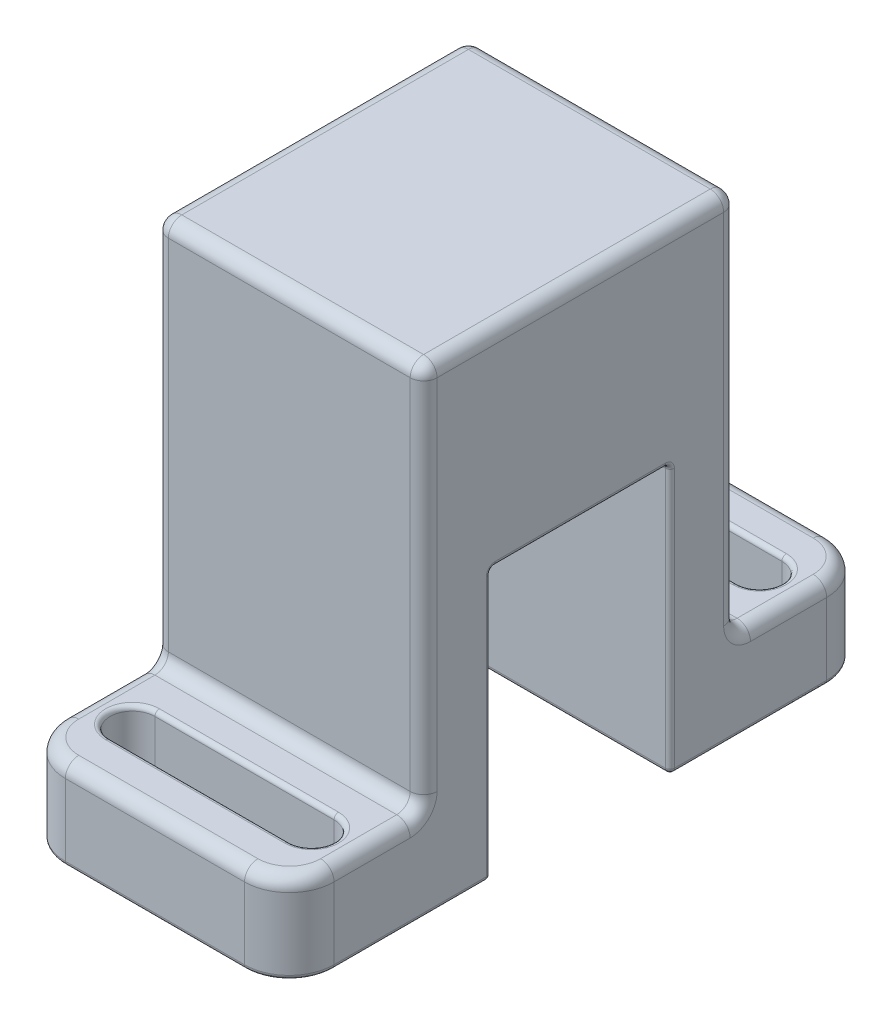
from build123d import *

# Parameters (mm, degrees)
SKETCH1_W               = 30
SKETCH1_H               = 35
BOSS_EXTRUDE1_DEPTH     = 53
SKETCH2_W               = 30
SKETCH2_H               = 65
BOSS_EXTRUDE2_DEPTH     = 10
CUT_EXTRUDE1_DEPTH      = 70.030790232
CUT_EXTRUDE1_DEPTH_BACK = 70.030790232
SKETCH3_W               = 20
SKETCH3_H               = 30
FILLET1_R               = 1.5
FILLET2_R               = 5
FILLET3_R               = 0.5


with BuildPart() as part:
    # Sketch1 → Boss-Extrude1 (new body)
    with BuildSketch(Plane(origin=(0, 0, 0), x_dir=(1, 0, 0), z_dir=(0, 1, 0))):
        Rectangle(SKETCH1_W, SKETCH1_H)
    extrude(amount=BOSS_EXTRUDE1_DEPTH)

    # Sketch2 → Boss-Extrude2 (add)
    with BuildSketch(Plane.XZ):
        Rectangle(SKETCH2_W, SKETCH2_H)
        with BuildLine():
            Line((-10, 27.5), (10, 27.5))
            ThreePointArc((10, 27.5), (12.5, 25), (10, 22.5))
            Line((10, 22.5), (-10, 22.5))
            ThreePointArc((-10, 22.5), (-12.5, 25), (-10, 27.5))
        make_face(mode=Mode.SUBTRACT)
        with BuildLine():
            Line((-10, -27.5), (10, -27.5))
            ThreePointArc((10, -27.5), (12.5, -25), (10, -22.5))
            Line((10, -22.5), (-10, -22.5))
            ThreePointArc((-10, -22.5), (-12.5, -25), (-10, -27.5))
        make_face(mode=Mode.SUBTRACT)
    extrude(amount=-BOSS_EXTRUDE2_DEPTH)

    # Sketch3 → Cut-Extrude1 (cut, two sides: drawn at the far end of the back side and taken through both)
    with BuildSketch(Plane.ZY.offset(15).offset(-CUT_EXTRUDE1_DEPTH_BACK)):
        with Locations((0, 15)):
            Rectangle(SKETCH3_W, SKETCH3_H)
    extrude(amount=CUT_EXTRUDE1_DEPTH + CUT_EXTRUDE1_DEPTH_BACK, mode=Mode.SUBTRACT)

    # Fillet1
    fillet1_edges = [part.edges().sort_by_distance(p)[0] for p in [
        (-15, 53, 0),
        (0, 10, 17.5),
        (0, 53, 17.5),
        (0, 10, -17.5),
        (15, 10, -25),
        (15, 10, 25),
        (-15, 10, -25),
        (-15, 10, 25),
        (0, 10, -32.5),
        (0, 10, 32.5),
        (15, 53, 0),
        (15, 31.5, 17.5),
        (-15, 31.5, 17.5),
        (-15, 31.5, -17.5),
        (15, 31.5, -17.5),
        (0, 53, -17.5),
    ]]
    fillet(fillet1_edges, radius=FILLET1_R)

    # Fillet2
    # the kernel refuses this fillet: 5 mm, written as the material it takes off along each edge
    with BuildSketch(Plane(origin=(-10, 10, 27.5), x_dir=(-1, 0, 0), z_dir=(0, 0, -1))) as fillet2_piece_1:
        with BuildLine():
            CenterArc((3.5, -1.5), 1.5, 0, 90)
            Line((5, -1.5), (5, 0))
            Line((5, 0), (3.5, 0))
        make_face()
    revolve(axis=Axis((-10, 10, 27.5), (0, 1, 0)), revolution_arc=90, mode=Mode.SUBTRACT)
    with BuildSketch(Plane(origin=(10, 10, 27.5), x_dir=(0, 0, 1), z_dir=(-1, 0, 0))) as fillet2_piece_2:
        with BuildLine():
            CenterArc((3.5, -1.5), 1.5, 0, 90)
            Line((5, -1.5), (5, 0))
            Line((5, 0), (3.5, 0))
        make_face()
    revolve(axis=Axis((10, 10, 27.5), (0, 1, 0)), revolution_arc=90, mode=Mode.SUBTRACT)
    with BuildSketch(Plane(origin=(-10, 10, -27.5), x_dir=(0, 0, -1), z_dir=(1, 0, 0))) as fillet2_piece_3:
        with BuildLine():
            CenterArc((3.5, -1.5), 1.5, 0, 90)
            Line((5, -1.5), (5, 0))
            Line((5, 0), (3.5, 0))
        make_face()
    revolve(axis=Axis((-10, 10, -27.5), (0, 1, 0)), revolution_arc=90, mode=Mode.SUBTRACT)
    with BuildSketch(Plane(origin=(10, 10, -27.5), x_dir=(1, 0, 0), z_dir=(0, 0, 1))) as fillet2_piece_4:
        with BuildLine():
            CenterArc((3.5, -1.5), 1.5, 0, 90)
            Line((5, -1.5), (5, 0))
            Line((5, 0), (3.5, 0))
        make_face()
    revolve(axis=Axis((10, 10, -27.5), (0, 1, 0)), revolution_arc=90, mode=Mode.SUBTRACT)
    with BuildSketch(Plane(origin=(15, -12.5, -32.5), x_dir=(0, 0, 1), z_dir=(0, 1, 0)), Plane(origin=(15, -12.5, 32.5), x_dir=(-1, 0, 0), z_dir=(0, 1, 0))) as fillet2_piece_5:
        with BuildLine():
            CenterArc((FILLET2_R, -FILLET2_R), FILLET2_R, 90, 90)
            Line((0, -FILLET2_R), (0, 0))
            Line((0, 0), (FILLET2_R, 0))
        make_face()
    extrude(amount=22.5, mode=Mode.SUBTRACT)
    with BuildSketch(Plane(origin=(-15, -12.5, 32.5), x_dir=(1, 0, 0), z_dir=(0, 1, 0)), Plane(origin=(-15, -12.5, -32.5), x_dir=(0, 0, 1), z_dir=(0, 1, 0))) as fillet2_piece_6:
        with BuildLine():
            CenterArc((FILLET2_R, FILLET2_R), FILLET2_R, 180, 90)
            Line((0, FILLET2_R), (0, 0))
            Line((0, 0), (FILLET2_R, 0))
        make_face()
    extrude(amount=22.5, mode=Mode.SUBTRACT)

    # Fillet3
    fillet3_edges = [part.edges().sort_by_distance(p)[0] for p in [
        (15, 0, 18.75),
        (0, 0, 32.5),
        (-13.535533906, 0, 31.035533906),
        (13.535533906, 0, 31.035533906),
        (-15, 0, -18.75),
        (0, 0, -32.5),
        (13.535533906, 0, -31.035533906),
        (-13.535533906, 0, -31.035533906),
        (0, 10, -22.5),
        (-12.5, 10, -25),
        (0, 10, -27.5),
        (12.5, 10, -25),
        (0, 10, 27.5),
        (-12.5, 10, 25),
        (0, 10, 22.5),
        (12.5, 10, 25),
        (-12.5, 0, 25),
        (0, 0, 27.5),
        (12.5, 0, 25),
        (0, 0, 22.5),
        (-12.5, 0, -25),
        (0, 0, -22.5),
        (12.5, 0, -25),
        (0, 0, -27.5),
        (15, 0, -18.75),
        (-15, 0, 18.75),
        (-15, 30, 0),
        (0, 0, 10),
        (0, 30, -10),
        (15, 30, 0),
        (0, 30, 10),
        (-15, 15, 10),
        (15, 15, 10),
        (0, 0, -10),
        (-15, 15, -10),
        (15, 15, -10),
    ]]
    fillet(fillet3_edges, radius=FILLET3_R)


solid = part.part
